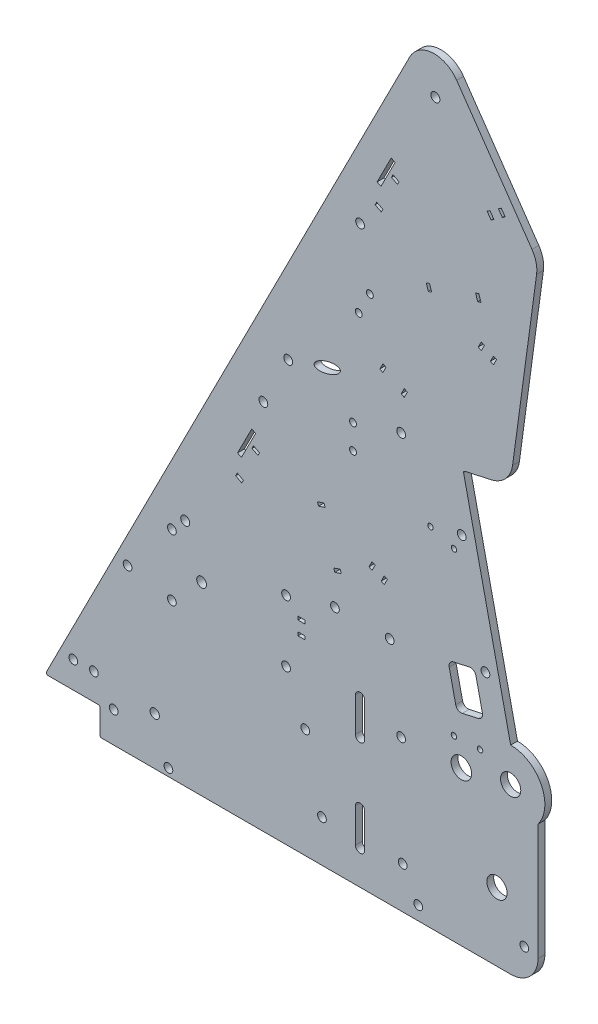
from build123d import *

# Parameters (mm, degrees)
BOSS_EXTRUDE1_DEPTH     = 3.175
SKETCH2_R               = 2.0955
SKETCH2_R_2             = 2.286
SKETCH2_R_3             = 2.032
SKETCH2_R_4             = 4.699
CUT_EXTRUDE1_DEPTH      = 421.976111717
SKETCH7_R               = 2.159
CUT_EXTRUDE2_DEPTH      = 421.976111717
CUT_EXTRUDE3_REACH      = 422.976
SKETCH10_R              = 2.032
FILLET1_R               = 12.7
FILLET2_R               = 0.79375
SKETCH12_R              = 2.032
CUT_EXTRUDE5_DEPTH      = 411.989226146
SKETCH13_R              = 2.032
SKETCH13_R_2            = 1.6
SKETCH13_RX             = 6.35
SKETCH13_RY             = 2.38125
SKETCH13_W              = 3.175
SKETCH13_H              = 1.5875
CUT_EXTRUDE6_DEPTH      = 411.989226146
CUT_EXTRUDE7_DEPTH      = 411.989226285
CUT_EXTRUDE7_DEPTH_BACK = 411.989226285
SKETCH14_R              = 1.27
SKETCH14_R_2            = 2.032
FILLET3_R               = 2.54
SKETCH15_R              = 4.7625
CUT_EXTRUDE8_DEPTH      = 411.989226285


with BuildPart() as part:
    # Sketch1 → Boss-Extrude1 (new body)
    with BuildSketch(Plane.XY):
        with BuildLine():
            Line((228.6, -12.7), (228.6, 53.975))
            ThreePointArc((228.6, 53.975), (230.099031657, 70.599515829), (215.9, 79.375))
            Line((215.9, 79.375), (193.909735224, 178.566674323))
            Line((193.909735224, 178.566674323), (215.607913982, 183.377044743))
            Line((215.607913982, 183.377044743), (228.6, 279.4))
            Line((228.6, 279.4), (178.754725958, 351.413083686))
            Line((178.754725958, 351.413083686), (0, 0))
            Line((0, 0), (25.4, 0))
            Line((25.4, 0), (25.4, -12.7))
            Line((25.4, -12.7), (228.6, -12.7))
        make_face()
    extrude(amount=BOSS_EXTRUDE1_DEPTH)

    # Sketch2 → Cut-Extrude1 (cut, through all)
    with BuildSketch(Plane.XY.offset(3.175)):
        with Locations((64.943150167, 94.057839899)):
            Circle(SKETCH2_R)
        with Locations((180.975, 322.164313376)):
            Circle(SKETCH2_R)
        with Locations((72.544547852, 73.173171402)):
            Circle(SKETCH2_R_2)
        with Locations((193.207821773, 152.394364194)):
            Circle(SKETCH2_R_3)
        with Locations((215.9, 63.5)):
            Circle(SKETCH2_R_4)
        with Locations((173.0375, -6.35)):
            Circle(SKETCH2_R_3)
        with Locations((204.202954161, 102.798527032)):
            Circle(SKETCH2_R_3)
        with Locations((209.55, 19.05)):
            Circle(SKETCH2_R_4)
        with Locations((165.1, 179.3875)):
            Circle(SKETCH2_R_3)
        with Locations((111.724047852, 87.460671402)):
            Circle(SKETCH2_R_3)
        with Locations((111.724047852, 58.885671402)):
            Circle(SKETCH2_R_3)
        with Locations((58.765047852, 58.885671402)):
            Circle(SKETCH2_R_3)
        with Locations((58.765047852, 87.460671402)):
            Circle(SKETCH2_R_3)
    extrude(amount=-CUT_EXTRUDE1_DEPTH, mode=Mode.SUBTRACT)

    # Sketch7 → Cut-Extrude2 (cut, through all)
    with BuildSketch(Plane.XY.offset(3.175)):
        with Locations((50.8, 9.525)):
            Circle(SKETCH7_R)
        with BuildLine():
            Line((143.891, 3.175), (143.891, 19.05))
            ThreePointArc((143.891, 19.05), (146.05, 21.209), (148.209, 19.05))
            Line((148.209, 19.05), (148.209, 3.175))
            ThreePointArc((148.209, 3.175), (146.05, 1.016), (143.891, 3.175))
        make_face()
        with BuildLine():
            Line((143.891, 47.625), (143.891, 63.5))
            ThreePointArc((143.891, 63.5), (146.05, 65.659), (148.209, 63.5))
            Line((148.209, 63.5), (148.209, 47.625))
            ThreePointArc((148.209, 47.625), (146.05, 45.466), (143.891, 47.625))
        make_face()
    extrude(amount=-CUT_EXTRUDE2_DEPTH, mode=Mode.SUBTRACT)

    # Sketch10 → Cut-Extrude3 (cut, up to next)
    with BuildSketch(Plane.XY.offset(3.175), mode=Mode.PRIVATE) as cut_extrude3_sk1:
        with Locations((120.65, 38.1)):
            Circle(SKETCH10_R)
    cut_extrude3_tool1 = extrude(cut_extrude3_sk1.sketch, amount=-CUT_EXTRUDE3_REACH, mode=Mode.PRIVATE) & part.part
    # Sketch10 → Cut-Extrude3 (cut, up to next)
    with BuildSketch(Plane.XY.offset(3.175), mode=Mode.PRIVATE) as cut_extrude3_sk2:
        with Locations((165.1, 57.15)):
            Circle(SKETCH10_R)
    cut_extrude3_tool2 = extrude(cut_extrude3_sk2.sketch, amount=-CUT_EXTRUDE3_REACH, mode=Mode.PRIVATE) & part.part
    # Sketch10 → Cut-Extrude3 (cut, up to next)
    with BuildSketch(Plane.XY.offset(3.175), mode=Mode.PRIVATE) as cut_extrude3_sk3:
        with Locations((13.046467246, 12.334704411)):
            Circle(SKETCH10_R)
    cut_extrude3_tool3 = extrude(cut_extrude3_sk3.sketch, amount=-CUT_EXTRUDE3_REACH, mode=Mode.PRIVATE) & part.part
    # Sketch10 → Cut-Extrude3 (cut, up to next)
    with BuildSketch(Plane.XY.offset(3.175), mode=Mode.PRIVATE) as cut_extrude3_sk4:
        with Locations((22.571467246, 12.334704411)):
            Circle(SKETCH10_R)
    cut_extrude3_tool4 = extrude(cut_extrude3_sk4.sketch, amount=-CUT_EXTRUDE3_REACH, mode=Mode.PRIVATE) & part.part
    # Sketch10 → Cut-Extrude3 (cut, up to next)
    with BuildSketch(Plane.XY.offset(3.175), mode=Mode.PRIVATE) as cut_extrude3_sk5:
        with Locations((38.211447917, 62.639810909)):
            Circle(SKETCH10_R)
    cut_extrude3_tool5 = extrude(cut_extrude3_sk5.sketch, amount=-CUT_EXTRUDE3_REACH, mode=Mode.PRIVATE) & part.part
    add(cut_extrude3_tool1.solids().sort_by_distance((120.65, 38.1, 3.175))[0], mode=Mode.SUBTRACT)
    add(cut_extrude3_tool2.solids().sort_by_distance((165.1, 57.15, 3.175))[0], mode=Mode.SUBTRACT)
    add(cut_extrude3_tool3.solids().sort_by_distance((13.046467, 12.334704, 3.175))[0], mode=Mode.SUBTRACT)
    add(cut_extrude3_tool4.solids().sort_by_distance((22.571467, 12.334704, 3.175))[0], mode=Mode.SUBTRACT)
    add(cut_extrude3_tool5.solids().sort_by_distance((38.211448, 62.639811, 3.175))[0], mode=Mode.SUBTRACT)

    # Fillet1
    fillet1_edges = [part.edges().sort_by_distance(p)[0] for p in [
        (228.6, -12.7, 1.5875),
        (178.754725958, 351.413083686, 1.5875),
        (215.607913982, 183.377044743, 1.5875),
        (228.6, 279.4, 1.5875),
    ]]
    fillet(fillet1_edges, radius=FILLET1_R)

    # Fillet2
    fillet2_edges = [part.edges().sort_by_distance(p)[0] for p in [
        (25.4, -12.7, 1.5875),
        (25.4, 0, 1.5875),
        (193.909735224, 178.566674323, 1.5875),
        (0, 0, 1.5875),
    ]]
    fillet(fillet2_edges, radius=FILLET2_R)

    # Sketch12 → Cut-Extrude5 (cut, through all)
    with BuildSketch(Plane.XY.offset(3.175)):
        with Locations((31.75, 1.5875)):
            Circle(SKETCH12_R)
        with Locations((173.0375, -6.35)):
            Circle(SKETCH12_R)
        with Locations((222.25, 1.5875)):
            Circle(SKETCH12_R)
        with Locations((57.15, -9.2075)):
            Circle(SKETCH12_R)
    extrude(amount=-CUT_EXTRUDE5_DEPTH, mode=Mode.SUBTRACT)

    # Sketch13 → Cut-Extrude6 (cut, through all)
    with BuildSketch(Plane.XY.offset(3.175)):
        with Locations((112.7125, 182.5625)):
            Circle(SKETCH13_R)
        with Locations((146.05, 254)):
            Circle(SKETCH13_R)
        with Locations((101.196445848, 159.923142748)):
            Circle(SKETCH13_R)
        with Locations((145.425401324, 217.737567137)):
            Circle(SKETCH13_R_2)
        with Locations((150.594024053, 227.898538502)):
            Circle(SKETCH13_R_2)
        with Locations((142.77464408, 160.990743845)):
            Circle(SKETCH13_R_2)
        with Locations((142.77464408, 172.390743845)):
            Circle(SKETCH13_R_2)
        with Locations(Location((130.826142263, 188.461522288), (0, 0, 18.038739462))):
            Ellipse(SKETCH13_RX, SKETCH13_RY)
        Polygon((178.26972852, 245.992253978), (176.758236028, 245.506922447), (177.728899089, 242.483937462), (179.240391581, 242.969268992), align=None)
        Polygon((153.938079759, 274.614823847), (160.502230626, 287.51925748), (162.284857181, 286.612481563), (155.720706315, 273.708047929), align=None)
        Polygon((200.609634347, 249.830809719), (202.12112684, 250.316141249), (201.150463779, 253.339126235), (199.638971286, 252.853794704), align=None)
        Polygon((160.590482388, 279.78010172), (163.420402045, 278.340594951), (164.140155429, 279.75555478), (161.310235773, 281.195061549), align=None)
        Polygon((153.789663007, 266.410402556), (153.069909623, 264.995442728), (155.899829279, 263.555935959), (156.619582664, 264.970895787), align=None)
        Polygon((89.229472678, 133.398809097), (95.793623545, 146.30324273), (97.5762501, 145.396466813), (91.012099234, 132.492033179), align=None)
        Polygon((96.601628692, 139.979046798), (99.431548348, 138.539540029), (98.711794964, 137.124580201), (95.881875307, 138.56408697), align=None)
        Polygon((89.081055926, 125.194387806), (91.910975583, 123.754881037), (91.191222198, 122.339921209), (88.361302542, 123.779427978), align=None)
        Polygon((126.30221941, 132.310008945), (126.800049834, 130.802586934), (129.814893856, 131.798247783), (129.317063431, 133.305669794), align=None)
        Polygon((133.838297958, 109.490892002), (134.336128382, 107.983469991), (137.350972404, 108.979130841), (136.853141979, 110.486552851), align=None)
        Polygon((203.709433187, 233.837093675), (202.294473359, 234.556847059), (200.85496659, 231.726927403), (202.269926418, 231.007174018), align=None)
        Polygon((206.514805903, 228.847913865), (207.929765731, 228.12816048), (209.3692725, 230.958080137), (207.954312672, 231.677833521), align=None)
        Polygon((211.540543439, 292.889033628), (210.235229039, 291.98553456), (212.042227175, 289.374905759), (213.347541575, 290.278404827), align=None)
        Polygon((206.319285837, 289.275037356), (205.013971437, 288.371538288), (206.820969573, 285.760909487), (208.126283974, 286.664408555), align=None)
        Polygon((155.228084113, 200.119678264), (156.643043941, 199.39992488), (158.08255071, 202.229844536), (156.667590882, 202.949597921), align=None)
        Polygon((165.132802911, 195.081404573), (166.547762739, 194.361651188), (167.987269508, 197.191570845), (166.57230968, 197.911324229), align=None)
        Polygon((151.629558299, 120.949261083), (150.19005153, 118.119341427), (151.605011359, 117.399588043), (153.044518128, 120.229507699), align=None)
        Polygon((155.849890843, 115.240327889), (157.289397612, 118.070247546), (158.704357441, 117.350494161), (157.264850672, 114.520574505), align=None)
        with Locations((118.836047852, 81.078921402)):
            Rectangle(SKETCH13_W, SKETCH13_H)
        with Locations((118.836047852, 74.728921402)):
            Rectangle(SKETCH13_W, SKETCH13_H)
    extrude(amount=-CUT_EXTRUDE6_DEPTH, mode=Mode.SUBTRACT)

    # Sketch14 → Cut-Extrude7 (cut, two sides: drawn at the far end of the back side and taken through both)
    with BuildSketch(Plane.XY.offset(3.175).offset(-CUT_EXTRUDE7_DEPTH_BACK)):
        with Locations((189.602197334, 69.980636704)):
            Circle(SKETCH14_R)
        with Locations((201.708862449, 70.509225118)):
            Circle(SKETCH14_R)
        with Locations((159.793547852, 93.98)):
            Circle(SKETCH14_R_2)
        with Locations((134.393547852, 93.98)):
            Circle(SKETCH14_R_2)
        with Locations((178.721644858, 148.532438598)):
            Circle(SKETCH14_R)
        with Locations((189.622629605, 145.09537131)):
            Circle(SKETCH14_R)
        with Locations((128.361047852, 6.6675)):
            Circle(SKETCH14_R_2)
        with Locations((165.826047852, 6.6675)):
            Circle(SKETCH14_R_2)
        Polygon((186.844411154, 98.950230697), (199.243370445, 101.699013794), (203.36654509, 83.100574858), (190.9675858, 80.351791761), align=None)
    extrude(amount=CUT_EXTRUDE7_DEPTH + CUT_EXTRUDE7_DEPTH_BACK, mode=Mode.SUBTRACT)

    # Fillet3
    fillet3_edges = [part.edges().sort_by_distance(p)[0] for p in [
        (199.243370445, 101.699013794, 1.5875),
        (186.844411154, 98.950230697, 1.5875),
        (190.9675858, 80.351791761, 1.5875),
        (203.36654509, 83.100574858, 1.5875),
    ]]
    fillet(fillet3_edges, radius=FILLET3_R)

    # Sketch15 → Cut-Extrude8 (cut, through all)
    with BuildSketch(Plane.XY.offset(3.175)):
        with Locations((193.04, 58.801)):
            Circle(SKETCH15_R)
    extrude(amount=-CUT_EXTRUDE8_DEPTH, mode=Mode.SUBTRACT)


solid = part.part
